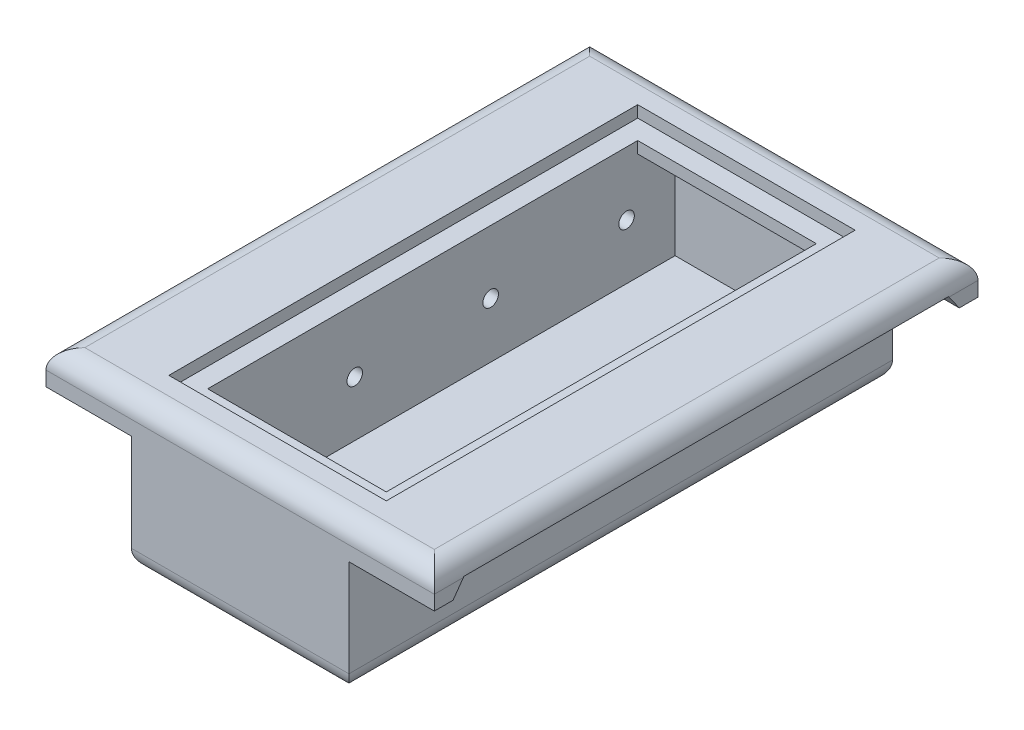
from build123d import *

# Parameters (mm, degrees)
SKETCH1_W           = 200
SKETCH1_H           = 150
BOSS_EXTRUDE1_DEPTH = 280
SKETCH2_W           = 44
SKETCH2_H           = 60
SKETCH2_W_2         = 34
SKETCH2_H_2         = 72.5
CUT_EXTRUDE1_DEPTH  = 280
CUT_EXTRUDE5_DEPTH  = 200
CUT_EXTRUDE8_DEPTH  = 44
CUT_EXTRUDE9_DEPTH  = 44
SKETCH6_W           = 112
SKETCH6_H           = 52.5
CUT_EXTRUDE7_DEPTH  = 280
FILLET1_START       = -100
FILLET1_DEPTH       = 200
FILLET1_START_2     = -76
FILLET1_2_DEPTH     = 10
FILLET1_START_3     = 66
FILLET1_3_DEPTH     = 10
FILLET1_START_4     = -66
FILLET1_4_DEPTH     = 132
FILLET1_START_5     = -281
FILLET1_5_DEPTH     = 282
SKETCH8_W           = 152
SKETCH8_H           = 72.5
CUT_EXTRUDE10_DEPTH = 280
SKETCH9_W           = 111.98598877
SKETCH9_H           = 241.482238642
SKETCH9_W_2         = 91.98598877
SKETCH9_H_2         = 221.482238642
SKETCH9_H_3         = 10
CUT_EXTRUDE11_DEPTH = 6
SKETCH9_3_W         = 45.992994385
SKETCH9_3_H         = 221.482238642
CUT_EXTRUDE12_DEPTH = 67
CUT_EXTRUDE13_START = -12
SKETCH9_7_W         = 91.98598877
SKETCH9_7_H         = 9.258880679
CUT_EXTRUDE13_DEPTH = 55
CUT_EXTRUDE14_START = -12
SKETCH9_9_W         = 91.98598877
SKETCH9_9_H         = 10
CUT_EXTRUDE14_DEPTH = 55
CUT_EXTRUDE15_REACH = 331.182
SKETCH11_R          = 4


with BuildPart() as part:
    # Sketch1 → Boss-Extrude1 (new body)
    with BuildSketch(Plane.XY):
        Rectangle(SKETCH1_W, SKETCH1_H)
    extrude(amount=-BOSS_EXTRUDE1_DEPTH)

    # Sketch2 → Cut-Extrude1 (cut)
    with BuildSketch(Plane.XY):
        with Locations((78, -45)):
            Rectangle(SKETCH2_W, SKETCH2_H)
        with Locations((-78, -45)):
            Rectangle(SKETCH2_W, SKETCH2_H)
        with Locations((83, 38.75)):
            Rectangle(SKETCH2_W_2, SKETCH2_H_2)
        with Locations((-83, 38.75)):
            Rectangle(SKETCH2_W_2, SKETCH2_H_2)
    extrude(amount=-CUT_EXTRUDE1_DEPTH, mode=Mode.SUBTRACT)

    # Sketch3 → Cut-Extrude5 (cut)
    with BuildSketch(Plane.ZY.offset(100)):
        Polygon((-280, 2.5), (-274.399041425, 2.5), (-252, 2.5), (-218.971094498, 75), (-280, 75), align=None)
        Polygon((-236.455453487, 12.5), (-168.766953205, 12.5), (-60.438488841, 12.5), (-94.602997447, 65), (-144.84946991, 65), (-212.537970192, 65), align=None)
        Polygon((-89.179559504, 75), (-42, 2.5), (-5.600958575, 2.5), (0, 2.5), (0, 75), align=None)
    extrude(amount=-CUT_EXTRUDE5_DEPTH, mode=Mode.SUBTRACT)

    # Sketch5 → Cut-Extrude8 (cut)
    with BuildSketch(Plane.ZY.offset(100)):
        Polygon((-264.773291637, -7.125749789), (-270.374250211, -15), (-140, -15), (-140, -7.125749789), align=None)
        Polygon((-15.226708363, -7.125749789), (-140, -7.125749789), (-140, -15), (-9.625749789, -15), align=None)
    extrude(amount=-CUT_EXTRUDE8_DEPTH, mode=Mode.SUBTRACT)

    # Sketch7 → Cut-Extrude9 (cut)
    with BuildSketch(Plane(origin=(100, 0, 0), x_dir=(0, 0, -1), z_dir=(1, 0, 0))):
        Polygon((9.625749789, -15), (15.226708363, -7.125749789), (264.773291637, -7.125749789), (270.374250211, -15), align=None)
    extrude(amount=-CUT_EXTRUDE9_DEPTH, mode=Mode.SUBTRACT)

    # Sketch6 → Cut-Extrude7 (cut)
    with BuildSketch(Plane.XY):
        with Locations((0, 38.75)):
            Rectangle(SKETCH6_W, SKETCH6_H)
    extrude(amount=-CUT_EXTRUDE7_DEPTH, mode=Mode.SUBTRACT)

    # Fillet1: read off the stored shape, not the designer's step
    # Fillet1 outline → Fillet1 (cut)
    with BuildSketch(Plane.YZ.offset(FILLET1_START)):
        with BuildLine():
            Line((-75, 0), (-75, -10))
            ThreePointArc((-75, -10), (-72.071067812, -2.928932188), (-65, 0))
            Line((-65, 0), (-75, 0))
        make_face()
        with BuildLine():
            ThreePointArc((-65, -280), (-72.071067812, -277.071067812), (-75, -270))
            Line((-75, -270), (-75, -280))
            Line((-75, -280), (-65, -280))
        make_face()
        with BuildLine():
            Line((2.5, 0), (-7.5, 0))
            ThreePointArc((-7.5, 0), (-0.428932188, -2.928932188), (2.5, -10))
            Line((2.5, -10), (2.5, 0))
        make_face()
        with BuildLine():
            ThreePointArc((2.5, -270), (-0.428932188, -277.071067812), (-7.5, -280))
            Line((-7.5, -280), (2.5, -280))
            Line((2.5, -280), (2.5, -270))
        make_face()
        with BuildLine():
            Line((75, -89.179559504), (70.454316835, -86.221444616))
            ThreePointArc((70.454316835, -86.221444616), (73.790425711, -89.835564613), (75, -94.602997447))
            Line((75, -94.602997447), (75, -89.179559504))
        make_face()
        with BuildLine():
            ThreePointArc((75, -212.537970192), (73.410042611, -217.948255145), (69.145763344, -221.638115591))
            Line((69.145763344, -221.638115591), (75, -218.971094498))
            Line((75, -218.971094498), (75, -212.537970192))
        make_face()
    extrude(amount=FILLET1_DEPTH, mode=Mode.SUBTRACT)

    # Fillet1 2 outline → Fillet1 2 (add)
    with BuildSketch(Plane.YZ.offset(FILLET1_START_2)):
        with BuildLine():
            ThreePointArc((7.045683165, -44.958114888), (3.709574289, -41.343994891), (2.5, -36.576562057))
            Line((2.5, -36.576562057), (2.5, -258.433124306))
            ThreePointArc((2.5, -258.433124306), (4.089957389, -253.022839352), (8.354236656, -249.332978906))
            Line((8.354236656, -249.332978906), (69.145763344, -221.638115591))
            ThreePointArc((69.145763344, -221.638115591), (73.410042611, -217.948255145), (75, -212.537970192))
            Line((75, -212.537970192), (75, -94.602997447))
            ThreePointArc((75, -94.602997447), (73.790425711, -89.835564613), (70.454316835, -86.221444616))
            Line((70.454316835, -86.221444616), (7.045683165, -44.958114888))
        make_face()
    extrude(amount=FILLET1_2_DEPTH)

    # Fillet1 3 outline → Fillet1 3 (add)
    with BuildSketch(Plane.YZ.offset(FILLET1_START_3)):
        with BuildLine():
            ThreePointArc((7.045683165, -44.958114888), (3.709574289, -41.343994891), (2.5, -36.576562057))
            Line((2.5, -36.576562057), (2.5, -258.433124306))
            ThreePointArc((2.5, -258.433124306), (4.089957389, -253.022839352), (8.354236656, -249.332978906))
            Line((8.354236656, -249.332978906), (69.145763344, -221.638115591))
            ThreePointArc((69.145763344, -221.638115591), (73.410042611, -217.948255145), (75, -212.537970192))
            Line((75, -212.537970192), (75, -94.602997447))
            ThreePointArc((75, -94.602997447), (73.790425711, -89.835564613), (70.454316835, -86.221444616))
            Line((70.454316835, -86.221444616), (7.045683165, -44.958114888))
        make_face()
    extrude(amount=FILLET1_3_DEPTH)

    # Fillet1 4 outline → Fillet1 4 (add)
    with BuildSketch(Plane.YZ.offset(FILLET1_START_4)):
        with BuildLine():
            ThreePointArc((7.045683165, -44.958114888), (3.709574289, -41.343994891), (2.5, -36.576562057))
            Line((2.5, -36.576562057), (2.5, -42))
            Line((2.5, -42), (7.045683165, -44.958114888))
        make_face()
        with BuildLine():
            Line((2.5, -252), (2.5, -258.433124306))
            ThreePointArc((2.5, -258.433124306), (4.089957389, -253.022839352), (8.354236656, -249.332978906))
            Line((8.354236656, -249.332978906), (2.5, -252))
        make_face()
    extrude(amount=FILLET1_4_DEPTH)

    # Fillet1 5 outline → Fillet1 5 (cut)
    with BuildSketch(Plane.XY.offset(FILLET1_START_5)):
        with BuildLine():
            ThreePointArc((56, 75), (63.071067812, 72.071067812), (66, 65))
            Line((66, 65), (66, 12.5))
            ThreePointArc((66, 12.5), (68.928932188, 5.428932188), (76, 2.5))
            Line((76, 2.5), (76, 75))
            Line((76, 75), (56, 75))
        make_face()
        with BuildLine():
            ThreePointArc((-66, 65), (-63.071067812, 72.071067812), (-56, 75))
            Line((-56, 75), (-76, 75))
            Line((-76, 75), (-76, 2.5))
            ThreePointArc((-76, 2.5), (-68.928932188, 5.428932188), (-66, 12.5))
            Line((-66, 12.5), (-66, 65))
        make_face()
        with BuildLine():
            Line((100, 2.5), (90, 2.5))
            ThreePointArc((90, 2.5), (97.071067812, -0.428932188), (100, -7.5))
            Line((100, -7.5), (100, 2.5))
        make_face()
        with BuildLine():
            Line((-90, 2.5), (-100, 2.5))
            Line((-100, 2.5), (-100, -7.5))
            ThreePointArc((-100, -7.5), (-97.071067812, -0.428932188), (-90, 2.5))
        make_face()
        with BuildLine():
            Line((56, -75), (56, -65))
            ThreePointArc((56, -65), (53.071067812, -72.071067812), (46, -75))
            Line((46, -75), (56, -75))
        make_face()
        with BuildLine():
            ThreePointArc((-46, -75), (-53.071067812, -72.071067812), (-56, -65))
            Line((-56, -65), (-56, -75))
            Line((-56, -75), (-46, -75))
        make_face()
    extrude(amount=FILLET1_5_DEPTH, mode=Mode.SUBTRACT)

    # Sketch8 → Cut-Extrude10 (cut)
    with BuildSketch(Plane.XY):
        with Locations((0, 38.75)):
            Rectangle(SKETCH8_W, SKETCH8_H)
    extrude(amount=-CUT_EXTRUDE10_DEPTH, mode=Mode.SUBTRACT)

    # Sketch9 → Cut-Extrude11 (cut)
    # profile 1 of 4: a face of its own
    with BuildSketch(Plane(origin=(0, 2.5, 0), x_dir=(1, 0, 0), z_dir=(0, 1, 0))):
        with Locations((0, 140)):
            Rectangle(SKETCH9_W, SKETCH9_H)
        with Locations((0, 140)):
            Rectangle(SKETCH9_W_2, SKETCH9_H_2, mode=Mode.SUBTRACT)
    # profile 2 of 4: a face of its own
    with BuildSketch(Plane(origin=(0, 2.5, 0), x_dir=(1, 0, 0), z_dir=(0, 1, 0))):
        Polygon((55.992994385, 260.741119321), (45.992994385, 260.741119321), (45.992994385, 250.741119321), (45.992994385, 29.258880679), (45.992994385, 19.258880679), (55.992994385, 19.258880679), align=None)
    # profile 3 of 4: a face of its own
    with BuildSketch(Plane(origin=(0, 2.5, 0), x_dir=(1, 0, 0), z_dir=(0, 1, 0))):
        with Locations((0, 255.741119321)):
            Rectangle(SKETCH9_W_2, SKETCH9_H_3)
    # profile 4 of 4: a face of its own
    with BuildSketch(Plane(origin=(0, 2.5, 0), x_dir=(1, 0, 0), z_dir=(0, 1, 0))):
        with Locations((0, 24.258880679)):
            Rectangle(SKETCH9_W_2, SKETCH9_H_3)
    extrude(amount=-CUT_EXTRUDE11_DEPTH, mode=Mode.SUBTRACT)

    # Sketch9<3> → Cut-Extrude12 (cut)
    with BuildSketch(Plane(origin=(0, 2.5, 0), x_dir=(1, 0, 0), z_dir=(0, 1, 0))):
        with Locations((-22.996497193, 140)):
            Rectangle(SKETCH9_3_W, SKETCH9_3_H)
        with Locations((22.996497193, 140)):
            Rectangle(SKETCH9_3_W, SKETCH9_3_H)
    extrude(amount=-CUT_EXTRUDE12_DEPTH, mode=Mode.SUBTRACT)

    # Sketch9<7> → Cut-Extrude13 (cut)
    with BuildSketch(Plane(origin=(0, 2.5, 0), x_dir=(1, 0, 0), z_dir=(0, 1, 0)).offset(CUT_EXTRUDE13_START)):
        with Locations((0, 265.370559661)):
            Rectangle(SKETCH9_7_W, SKETCH9_7_H)
        with Locations((0, 14.62944034)):
            Rectangle(SKETCH9_7_W, SKETCH9_7_H)
    extrude(amount=-CUT_EXTRUDE13_DEPTH, mode=Mode.SUBTRACT)

    # Sketch9<9> → Cut-Extrude14 (cut)
    with BuildSketch(Plane(origin=(0, 2.5, 0), x_dir=(1, 0, 0), z_dir=(0, 1, 0)).offset(CUT_EXTRUDE14_START)):
        with Locations((0, 255.741119321)):
            Rectangle(SKETCH9_9_W, SKETCH9_9_H)
        with Locations((0, 24.258880679)):
            Rectangle(SKETCH9_9_W, SKETCH9_9_H)
    extrude(amount=-CUT_EXTRUDE14_DEPTH, mode=Mode.SUBTRACT)

    # Cut-Extrude15: up to this face of the body (flat: up to its plane)
    cut_extrude15_end = Plane(part.part.faces().sort_by_distance((56, -36.372089238, -140))[0])
    # Sketch11 → Cut-Extrude15 (cut, up to the picked face)
    with BuildSketch(Plane.ZY.offset(56), mode=Mode.PRIVATE) as cut_extrude15_sk1:
        with Locations((-35, -36.062874894)):
            Circle(SKETCH11_R)
    cut_extrude15_tool1 = split(extrude(cut_extrude15_sk1.sketch, amount=-CUT_EXTRUDE15_REACH, mode=Mode.PRIVATE), bisect_by=cut_extrude15_end, keep=Keep.BOTH, mode=Mode.PRIVATE)
    # Sketch11 → Cut-Extrude15 (cut, up to the picked face)
    with BuildSketch(Plane.ZY.offset(56), mode=Mode.PRIVATE) as cut_extrude15_sk2:
        with Locations((-105, -36.062874894)):
            Circle(SKETCH11_R)
    cut_extrude15_tool2 = split(extrude(cut_extrude15_sk2.sketch, amount=-CUT_EXTRUDE15_REACH, mode=Mode.PRIVATE), bisect_by=cut_extrude15_end, keep=Keep.BOTH, mode=Mode.PRIVATE)
    # Sketch11 → Cut-Extrude15 (cut, up to the picked face)
    with BuildSketch(Plane.ZY.offset(56), mode=Mode.PRIVATE) as cut_extrude15_sk3:
        with Locations((-175, -36.062874894)):
            Circle(SKETCH11_R)
    cut_extrude15_tool3 = split(extrude(cut_extrude15_sk3.sketch, amount=-CUT_EXTRUDE15_REACH, mode=Mode.PRIVATE), bisect_by=cut_extrude15_end, keep=Keep.BOTH, mode=Mode.PRIVATE)
    # Sketch11 → Cut-Extrude15 (cut, up to the picked face)
    with BuildSketch(Plane.ZY.offset(56), mode=Mode.PRIVATE) as cut_extrude15_sk4:
        with Locations((-245, -36.062874894)):
            Circle(SKETCH11_R)
    cut_extrude15_tool4 = split(extrude(cut_extrude15_sk4.sketch, amount=-CUT_EXTRUDE15_REACH, mode=Mode.PRIVATE), bisect_by=cut_extrude15_end, keep=Keep.BOTH, mode=Mode.PRIVATE)
    add(cut_extrude15_tool1.solids().sort_by(Axis((-56, -36.062875, -35), (1, 0, 0)))[0], mode=Mode.SUBTRACT)
    add(cut_extrude15_tool2.solids().sort_by(Axis((-56, -36.062875, -105), (1, 0, 0)))[0], mode=Mode.SUBTRACT)
    add(cut_extrude15_tool3.solids().sort_by(Axis((-56, -36.062875, -175), (1, 0, 0)))[0], mode=Mode.SUBTRACT)
    add(cut_extrude15_tool4.solids().sort_by(Axis((-56, -36.062875, -245), (1, 0, 0)))[0], mode=Mode.SUBTRACT)


solid = part.part
